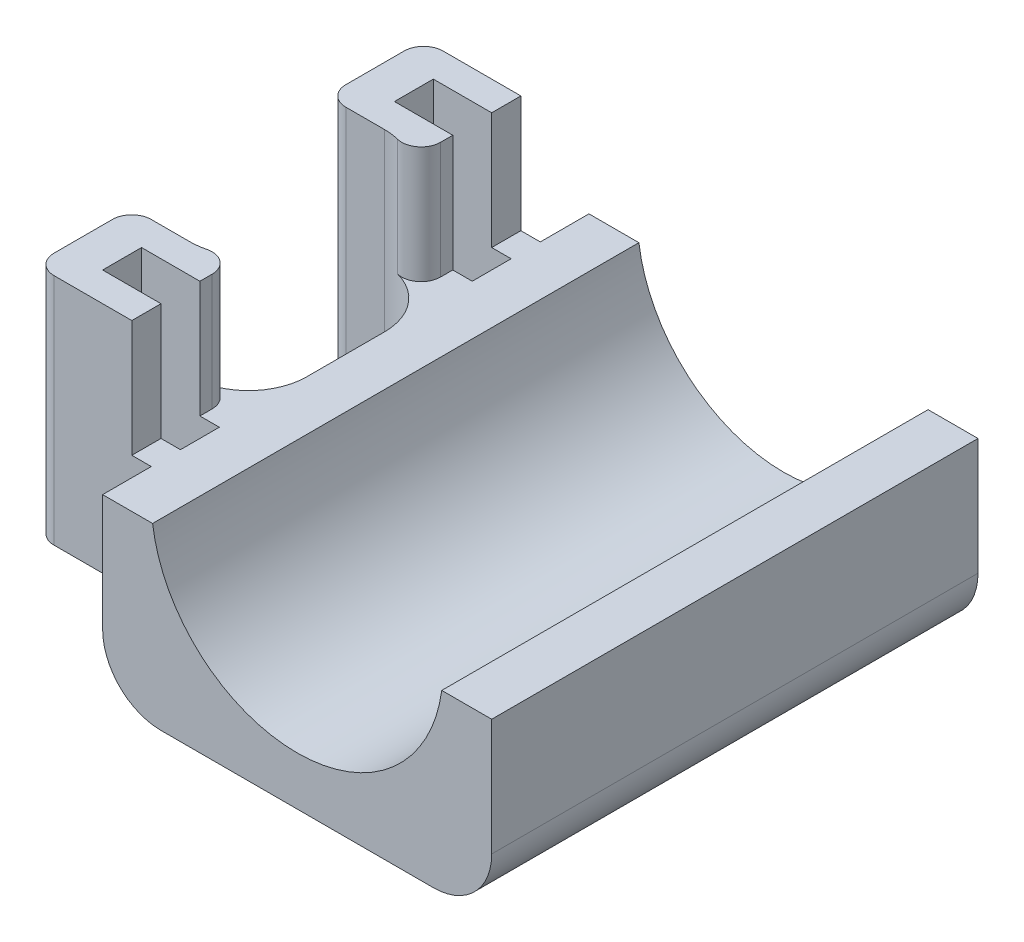
from build123d import *

# Parameters (mm, degrees)
ESBO_O1_W                = 20
ESBO_O1_H                = 25
RESSALTO_EXTRUS_O1_DEPTH = 9
ESBO_O2_R                = 7.5
CORTE_EXTRUS_O1_DEPTH    = 29.390139133
FILETE1_R                = 3
RESSALTO_EXTRUS_O2_DEPTH = 6
RESSALTO_EXTRUS_O3_DEPTH = 6
FILETE3_R                = 1
FILETE5_R                = 3
FILETE6_R                = 1


with BuildPart() as part:
    # Esboço1 → Ressalto-extrusão1 (new body)
    with BuildSketch(Plane(origin=(0, 0, 0), x_dir=(1, 0, 0), z_dir=(0, 1, 0))):
        Rectangle(ESBO_O1_W, ESBO_O1_H)
    extrude(amount=RESSALTO_EXTRUS_O1_DEPTH)

    # Esboço2 → Corte-extrusão1 (cut, through all)
    with BuildSketch(Plane.XY.offset(12.5)):
        with Locations((0, 10)):
            Circle(ESBO_O2_R)
    extrude(amount=-CORTE_EXTRUS_O1_DEPTH, mode=Mode.SUBTRACT)

    # Filete1
    filete1_edges = [part.edges().sort_by_distance(p)[0] for p in [
        (-10, 0, 0),
        (10, 0, 0),
    ]]
    fillet(filete1_edges, radius=FILETE1_R)

    # Esboço3 → Ressalto-extrusão2 (add)
    with BuildSketch(Plane(origin=(0, 9, 0), x_dir=(1, 0, 0), z_dir=(0, 1, 0))):
        Polygon((-16, 10), (-10, 10), (-10, 8.5), (-14, 8.5), (-14, 6.5), (-10, 6.5), (-10, 5), (-16, 5), align=None)
        Polygon((-14, -6.5), (-10, -6.5), (-10, -5), (-16, -5), (-16, -10), (-10, -10), (-10, -8.5), (-14, -8.5), align=None)
    extrude(amount=-RESSALTO_EXTRUS_O2_DEPTH)

    # Esboço4 → Ressalto-extrusão3 (add)
    with BuildSketch(Plane(origin=(0, 9, 0), x_dir=(1, 0, 0), z_dir=(0, 1, 0))):
        Polygon((-16, -10), (-16, -5), (-11, -5), (-11, -6.5), (-14, -6.5), (-14, -8.5), (-11, -8.5), (-11, -10), align=None)
        Polygon((-11, 10), (-16, 10), (-16, 5), (-11, 5), (-11, 6.5), (-14, 6.5), (-14, 8.5), (-11, 8.5), align=None)
    extrude(amount=RESSALTO_EXTRUS_O3_DEPTH)

    # Filete3
    filete3_edges = [part.edges().sort_by_distance(p)[0] for p in [
        (-16, 9, -5),
        (-16, 9, -10),
        (-16, 9, 10),
        (-16, 9, 5),
    ]]
    fillet(filete3_edges, radius=FILETE3_R)

    # Filete5
    # the kernel refuses this fillet: 3 mm, written as the material it adds along each edge
    with BuildSketch(Plane(origin=(-10, 16.5, -5), x_dir=(-1, 0, 0), z_dir=(0, -1, 0))) as filete5_piece_1_section:
        with BuildLine():
            CenterArc((FILETE5_R, -FILETE5_R), FILETE5_R, 90, 90)
            Line((0, -FILETE5_R), (0, 0))
            Line((0, 0), (FILETE5_R, 0))
        make_face()
    filete5_piece_1 = extrude(amount=13.5, mode=Mode.PRIVATE)
    filete5_piece_1 = split(filete5_piece_1, bisect_by=Plane(origin=(-11.589070595, 9, -4.827479681), z_dir=(0, 1, 0)), keep=Keep.TOP, mode=Mode.PRIVATE)
    filete5_piece_1 = split(filete5_piece_1, bisect_by=Plane(origin=(-11, 12, -4.827479681), z_dir=(-1, 0, 0)), keep=Keep.TOP, mode=Mode.PRIVATE)
    filete5_piece_1 = split(filete5_piece_1, bisect_by=Plane(origin=(-11.589070595, 15, -4.827479681), z_dir=(0, -1, 0)), keep=Keep.TOP, mode=Mode.PRIVATE)
    add(filete5_piece_1)
    with BuildSketch(Plane(origin=(-10, 9, -5), x_dir=(-1, 0, 0), z_dir=(0, -1, 0))) as filete5_piece_2_section:
        with BuildLine():
            CenterArc((FILETE5_R, -FILETE5_R), FILETE5_R, 90, 90)
            Line((0, -FILETE5_R), (0, 0))
            Line((0, 0), (FILETE5_R, 0))
        make_face()
    filete5_piece_2 = extrude(amount=6, mode=Mode.PRIVATE)
    filete5_piece_2 = split(filete5_piece_2, bisect_by=Plane(origin=(-11, 6, -4.827479681), z_dir=(-1, 0, 0)), keep=Keep.TOP, mode=Mode.PRIVATE)
    add(filete5_piece_2)
    with BuildSketch(Plane(origin=(-10, 9, -5), x_dir=(-1, 0, 0), z_dir=(0, -1, 0))) as filete5_piece_3_section:
        with BuildLine():
            CenterArc((FILETE5_R, -FILETE5_R), FILETE5_R, 90, 90)
            Line((0, -FILETE5_R), (0, 0))
            Line((0, 0), (FILETE5_R, 0))
        make_face()
    filete5_piece_3 = extrude(amount=6, mode=Mode.PRIVATE)
    filete5_piece_3 = split(filete5_piece_3, bisect_by=Plane(origin=(-11, 6, -4.141402177), z_dir=(1, 0, 0)), keep=Keep.TOP, mode=Mode.PRIVATE)
    add(filete5_piece_3)
    with BuildSketch(Plane(origin=(-10, 16.5, 5), x_dir=(-1, 0, 0), z_dir=(0, -1, 0))) as filete5_piece_4_section:
        with BuildLine():
            CenterArc((FILETE5_R, FILETE5_R), FILETE5_R, 180, 90)
            Line((0, FILETE5_R), (0, 0))
            Line((0, 0), (FILETE5_R, 0))
        make_face()
    filete5_piece_4 = extrude(amount=13.5, mode=Mode.PRIVATE)
    filete5_piece_4 = split(filete5_piece_4, bisect_by=Plane(origin=(-11.589070595, 15, 4.827479681), z_dir=(0, -1, 0)), keep=Keep.TOP, mode=Mode.PRIVATE)
    filete5_piece_4 = split(filete5_piece_4, bisect_by=Plane(origin=(-11.589070595, 9, 4.827479681), z_dir=(0, 1, 0)), keep=Keep.TOP, mode=Mode.PRIVATE)
    filete5_piece_4 = split(filete5_piece_4, bisect_by=Plane(origin=(-11, 12, 4.827479681), z_dir=(-1, 0, 0)), keep=Keep.TOP, mode=Mode.PRIVATE)
    add(filete5_piece_4)
    with BuildSketch(Plane(origin=(-10, 9, 5), x_dir=(-1, 0, 0), z_dir=(0, -1, 0))) as filete5_piece_5_section:
        with BuildLine():
            CenterArc((FILETE5_R, FILETE5_R), FILETE5_R, 180, 90)
            Line((0, FILETE5_R), (0, 0))
            Line((0, 0), (FILETE5_R, 0))
        make_face()
    filete5_piece_5 = extrude(amount=6, mode=Mode.PRIVATE)
    filete5_piece_5 = split(filete5_piece_5, bisect_by=Plane(origin=(-11, 6, 4.827479681), z_dir=(-1, 0, 0)), keep=Keep.TOP, mode=Mode.PRIVATE)
    add(filete5_piece_5)
    with BuildSketch(Plane(origin=(-10, 9, 5), x_dir=(-1, 0, 0), z_dir=(0, -1, 0))) as filete5_piece_6_section:
        with BuildLine():
            CenterArc((FILETE5_R, FILETE5_R), FILETE5_R, 180, 90)
            Line((0, FILETE5_R), (0, 0))
            Line((0, 0), (FILETE5_R, 0))
        make_face()
    filete5_piece_6 = extrude(amount=6, mode=Mode.PRIVATE)
    filete5_piece_6 = split(filete5_piece_6, bisect_by=Plane(origin=(-11, 6, 4.141402177), z_dir=(1, 0, 0)), keep=Keep.TOP, mode=Mode.PRIVATE)
    add(filete5_piece_6)

    # Filete6
    filete6_edges = [part.edges().sort_by_distance(p)[0] for p in [
        (-11, 12, -4.236067977),
        (-11, 12, 4.236067977),
    ]]
    fillet(filete6_edges, radius=FILETE6_R)


solid = part.part
